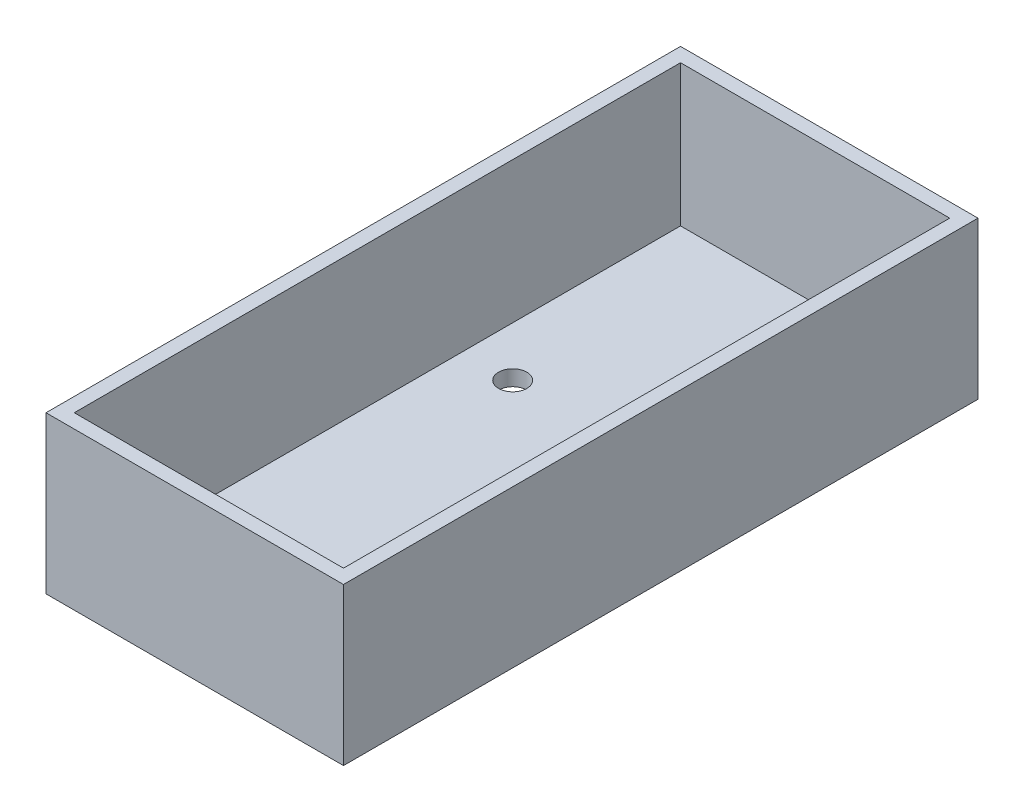
from build123d import *

# Parameters (mm, degrees)
SKETCH_1_W          = 42.1
SKETCH_1_H          = 89.8
EXTRUDE_1_DEPTH     = 22.2
SKETCH_2_W          = 38.1
SKETCH_2_H          = 85.8
CUT_EXTRUDE_1_DEPTH = 20
SKETCH_3_R          = 2
CUT_EXTRUDE_2_DEPTH = 54.47066953


with BuildPart() as part:
    # 스케치1 → 보스-돌출1 (new body)
    with BuildSketch(Plane(origin=(0, 0, 0), x_dir=(1, 0, 0), z_dir=(0, 1, 0))):
        Rectangle(SKETCH_1_W, SKETCH_1_H)
    extrude(amount=EXTRUDE_1_DEPTH)

    # 스케치2 → 컷-돌출1 (cut)
    with BuildSketch(Plane(origin=(0, 22.2, 0), x_dir=(1, 0, 0), z_dir=(0, 1, 0))):
        Rectangle(SKETCH_2_W, SKETCH_2_H)
    extrude(amount=-CUT_EXTRUDE_1_DEPTH, mode=Mode.SUBTRACT)

    # 스케치3 → 컷-돌출2 (cut, through all)
    with BuildSketch(Plane(origin=(0, 2.2, 0), x_dir=(1, 0, 0), z_dir=(0, 1, 0))):
        with Locations((-12, -27.9)):
            Circle(SKETCH_3_R)
        with Locations((-12, 12.1)):
            Circle(SKETCH_3_R)
        with Locations((12, 12.1)):
            Circle(SKETCH_3_R)
        with Locations((12, -27.9)):
            Circle(SKETCH_3_R)
    extrude(amount=-CUT_EXTRUDE_2_DEPTH, mode=Mode.SUBTRACT)


solid = part.part
